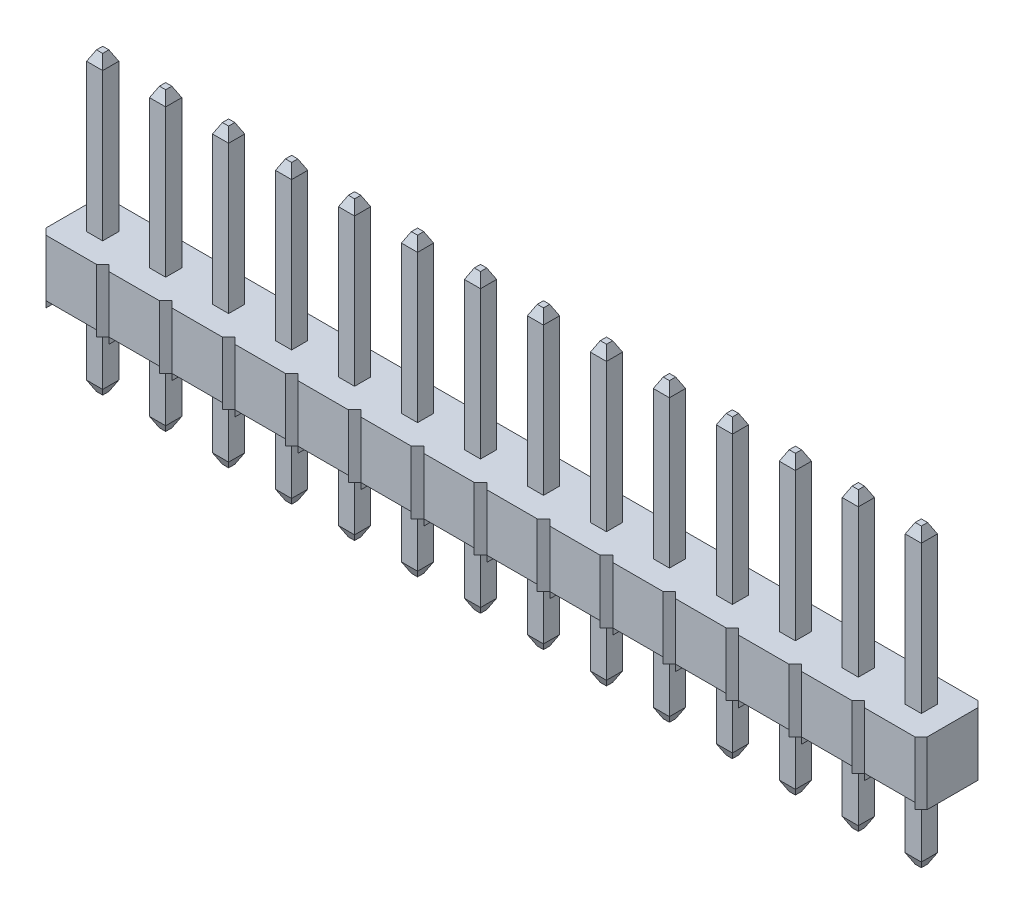
from build123d import *
from OCP.BRepFilletAPI import BRepFilletAPI_MakeChamfer

# Parameters (mm, degrees)
BOSS_EXTRUDE1_START  = -2.286
BOSS_EXTRUDE1_DEPTH  = 2.54
SKETCH2_W            = 2.032
SKETCH2_H            = 2.54
CUT_EXTRUDE1_DEPTH   = 0.254
SKETCH3_W            = 2.032
SKETCH3_H            = 2.54
CUT_EXTRUDE2_DEPTH   = 0.254
SKETCH4_W            = 2.032
SKETCH4_H            = 2.54
CUT_EXTRUDE3_DEPTH   = 0.254
SKETCH5_W            = 2.032
SKETCH5_H            = 2.54
CUT_EXTRUDE4_DEPTH   = 0.254
SKETCH6_W            = 2.032
SKETCH6_H            = 2.54
CUT_EXTRUDE5_DEPTH   = 0.254
SKETCH7_W            = 2.032
SKETCH7_H            = 2.54
CUT_EXTRUDE6_DEPTH   = 0.254
SKETCH8_W            = 2.032
SKETCH8_H            = 2.54
CUT_EXTRUDE7_DEPTH   = 0.254
SKETCH9_W            = 2.032
SKETCH9_H            = 2.54
CUT_EXTRUDE8_DEPTH   = 0.254
SKETCH10_W           = 2.032
SKETCH10_H           = 2.54
CUT_EXTRUDE9_DEPTH   = 0.254
SKETCH11_W           = 2.032
SKETCH11_H           = 2.54
CUT_EXTRUDE10_DEPTH  = 0.254
SKETCH12_W           = 2.032
SKETCH12_H           = 2.54
CUT_EXTRUDE11_DEPTH  = 0.254
SKETCH13_W           = 2.032
SKETCH13_H           = 2.54
CUT_EXTRUDE12_DEPTH  = 0.254
SKETCH14_W           = 2.032
SKETCH14_H           = 2.54
CUT_EXTRUDE13_DEPTH  = 0.254
CUT_EXTRUDE14_DEPTH  = 0.254
CUT_EXTRUDE15_DEPTH  = 0.254
BOSS_EXTRUDE2_DEPTH  = 0.254
BOSS_EXTRUDE3_DEPTH  = 0.254
SKETCH19_W           = 0.65
SKETCH19_H           = 0.65
BOSS_EXTRUDE4_DEPTH  = 3.302
SKETCH20_W           = 0.65
SKETCH20_H           = 0.65
BOSS_EXTRUDE5_DEPTH  = 3.302
SKETCH21_W           = 0.65
SKETCH21_H           = 0.65
BOSS_EXTRUDE6_DEPTH  = 3.302
SKETCH22_W           = 0.65
SKETCH22_H           = 0.65
BOSS_EXTRUDE7_DEPTH  = 3.302
SKETCH23_W           = 0.65
SKETCH23_H           = 0.65
BOSS_EXTRUDE8_DEPTH  = 3.302
SKETCH24_W           = 0.65
SKETCH24_H           = 0.65
BOSS_EXTRUDE9_DEPTH  = 3.302
SKETCH25_W           = 0.65
SKETCH25_H           = 0.65
BOSS_EXTRUDE10_DEPTH = 3.302
SKETCH26_W           = 0.65
SKETCH26_H           = 0.65
BOSS_EXTRUDE11_DEPTH = 3.302
SKETCH27_W           = 0.65
SKETCH27_H           = 0.65
BOSS_EXTRUDE12_DEPTH = 3.302
SKETCH28_W           = 0.65
SKETCH28_H           = 0.65
BOSS_EXTRUDE13_DEPTH = 3.302
SKETCH29_W           = 0.65
SKETCH29_H           = 0.65
BOSS_EXTRUDE14_DEPTH = 3.302
SKETCH30_W           = 0.65
SKETCH30_H           = 0.65
BOSS_EXTRUDE15_DEPTH = 3.302
SKETCH31_W           = 0.65
SKETCH31_H           = 0.65
BOSS_EXTRUDE16_DEPTH = 3.302
SKETCH32_W           = 0.65
SKETCH32_H           = 0.65
BOSS_EXTRUDE17_DEPTH = 3.302
SKETCH33_W           = 0.65
SKETCH33_H           = 0.65
BOSS_EXTRUDE18_DEPTH = 3.302
SKETCH34_W           = 0.65
SKETCH34_H           = 0.65
BOSS_EXTRUDE19_DEPTH = 6.35
SKETCH35_W           = 0.65
SKETCH35_H           = 0.65
BOSS_EXTRUDE20_DEPTH = 6.35
SKETCH36_W           = 0.65
SKETCH36_H           = 0.65
BOSS_EXTRUDE21_DEPTH = 6.35
SKETCH37_W           = 0.65
SKETCH37_H           = 0.65
BOSS_EXTRUDE22_DEPTH = 6.35
SKETCH38_W           = 0.65
SKETCH38_H           = 0.65
BOSS_EXTRUDE23_DEPTH = 6.35
SKETCH39_W           = 0.65
SKETCH39_H           = 0.65
BOSS_EXTRUDE24_DEPTH = 6.35
SKETCH40_W           = 0.65
SKETCH40_H           = 0.65
BOSS_EXTRUDE25_DEPTH = 6.35
SKETCH41_W           = 0.65
SKETCH41_H           = 0.65
BOSS_EXTRUDE26_DEPTH = 6.35
SKETCH42_W           = 0.65
SKETCH42_H           = 0.65
BOSS_EXTRUDE27_DEPTH = 6.35
SKETCH43_W           = 0.65
SKETCH43_H           = 0.65
BOSS_EXTRUDE28_DEPTH = 6.35
SKETCH44_W           = 0.65
SKETCH44_H           = 0.65
BOSS_EXTRUDE29_DEPTH = 6.35
SKETCH45_W           = 0.65
SKETCH45_H           = 0.65
BOSS_EXTRUDE30_DEPTH = 6.35
SKETCH46_W           = 0.65
SKETCH46_H           = 0.65
BOSS_EXTRUDE31_DEPTH = 6.35
SKETCH47_W           = 0.65
SKETCH47_H           = 0.65
BOSS_EXTRUDE32_DEPTH = 6.35
SKETCH48_W           = 0.65
SKETCH48_H           = 0.65
BOSS_EXTRUDE33_DEPTH = 6.35
CHAMFER1_SIZE        = 0.254
CHAMFER2_SIZE        = 0.2
CHAMFER2_SIZE2       = 0.4
SKETCH49_W           = 2.564316688
SKETCH49_H           = 3.089053424
CUT_EXTRUDE16_DEPTH  = 39.737290096


with BuildPart() as part:
    # Boss-Extrude1: read off the stored shape, not the designer's step
    # Boss-Extrude1 outline → Boss-Extrude1 (new body)
    with BuildSketch(Plane.XZ.offset(-0.254).offset(BOSS_EXTRUDE1_START)):
        Polygon((31.496, -1.27), (31.75, -1.016), (32.004, -1.27), (34.036, -1.27), (34.29, -1.016), (34.544, -1.27), (36.576, -1.27), (36.83, -1.016), (36.83, 1.27), (34.544, 1.27), (34.29, 1.016), (34.036, 1.27), (32.004, 1.27), (31.75, 1.016), (31.496, 1.27), (29.464, 1.27), (29.21, 1.016), (28.956, 1.27), (26.924, 1.27), (26.67, 1.016), (26.416, 1.27), (24.384, 1.27), (24.13, 1.016), (23.876, 1.27), (21.844, 1.27), (21.59, 1.016), (21.336, 1.27), (19.304, 1.27), (19.05, 1.016), (18.796, 1.27), (16.764, 1.27), (16.51, 1.016), (16.256, 1.27), (14.224, 1.27), (13.97, 1.016), (13.716, 1.27), (11.684, 1.27), (11.43, 1.016), (11.176, 1.27), (9.144, 1.27), (8.89, 1.016), (8.636, 1.27), (6.604, 1.27), (6.35, 1.016), (6.096, 1.27), (4.064, 1.27), (3.81, 1.016), (3.556, 1.27), (1.524, 1.27), (1.27, 1.016), (1.016, 1.27), (-1.016, 1.27), (-1.27, 1.016), (-1.27, -1.27), (1.016, -1.27), (1.27, -1.016), (1.524, -1.27), (3.556, -1.27), (3.81, -1.016), (4.064, -1.27), (6.096, -1.27), (6.35, -1.016), (6.604, -1.27), (8.636, -1.27), (8.89, -1.016), (9.144, -1.27), (11.176, -1.27), (11.43, -1.016), (11.684, -1.27), (13.716, -1.27), (13.97, -1.016), (14.224, -1.27), (16.256, -1.27), (16.51, -1.016), (16.764, -1.27), (18.796, -1.27), (19.05, -1.016), (19.304, -1.27), (21.336, -1.27), (21.59, -1.016), (21.844, -1.27), (23.876, -1.27), (24.13, -1.016), (24.384, -1.27), (26.416, -1.27), (26.67, -1.016), (26.924, -1.27), (28.956, -1.27), (29.21, -1.016), (29.464, -1.27), align=None)
    extrude(amount=BOSS_EXTRUDE1_DEPTH)

    # Sketch2 → Cut-Extrude1 (cut)
    with BuildSketch(Plane.XZ):
        with Locations((17.78, 0)):
            Rectangle(SKETCH2_W, SKETCH2_H)
    extrude(amount=-CUT_EXTRUDE1_DEPTH, mode=Mode.SUBTRACT)

    # Sketch3 → Cut-Extrude2 (cut)
    with BuildSketch(Plane.XZ):
        with Locations((15.24, 0)):
            Rectangle(SKETCH3_W, SKETCH3_H)
    extrude(amount=-CUT_EXTRUDE2_DEPTH, mode=Mode.SUBTRACT)

    # Sketch4 → Cut-Extrude3 (cut)
    with BuildSketch(Plane.XZ):
        with Locations((20.32, 0)):
            Rectangle(SKETCH4_W, SKETCH4_H)
    extrude(amount=-CUT_EXTRUDE3_DEPTH, mode=Mode.SUBTRACT)

    # Sketch5 → Cut-Extrude4 (cut)
    with BuildSketch(Plane.XZ):
        with Locations((12.7, 0)):
            Rectangle(SKETCH5_W, SKETCH5_H)
    extrude(amount=-CUT_EXTRUDE4_DEPTH, mode=Mode.SUBTRACT)

    # Sketch6 → Cut-Extrude5 (cut)
    with BuildSketch(Plane.XZ):
        with Locations((22.86, 0)):
            Rectangle(SKETCH6_W, SKETCH6_H)
    extrude(amount=-CUT_EXTRUDE5_DEPTH, mode=Mode.SUBTRACT)

    # Sketch7 → Cut-Extrude6 (cut)
    with BuildSketch(Plane.XZ):
        with Locations((10.16, 0)):
            Rectangle(SKETCH7_W, SKETCH7_H)
    extrude(amount=-CUT_EXTRUDE6_DEPTH, mode=Mode.SUBTRACT)

    # Sketch8 → Cut-Extrude7 (cut)
    with BuildSketch(Plane.XZ):
        with Locations((25.4, 0)):
            Rectangle(SKETCH8_W, SKETCH8_H)
    extrude(amount=-CUT_EXTRUDE7_DEPTH, mode=Mode.SUBTRACT)

    # Sketch9 → Cut-Extrude8 (cut)
    with BuildSketch(Plane.XZ):
        with Locations((7.62, 0)):
            Rectangle(SKETCH9_W, SKETCH9_H)
    extrude(amount=-CUT_EXTRUDE8_DEPTH, mode=Mode.SUBTRACT)

    # Sketch10 → Cut-Extrude9 (cut)
    with BuildSketch(Plane.XZ):
        with Locations((27.94, 0)):
            Rectangle(SKETCH10_W, SKETCH10_H)
    extrude(amount=-CUT_EXTRUDE9_DEPTH, mode=Mode.SUBTRACT)

    # Sketch11 → Cut-Extrude10 (cut)
    with BuildSketch(Plane.XZ):
        with Locations((5.08, 0)):
            Rectangle(SKETCH11_W, SKETCH11_H)
    extrude(amount=-CUT_EXTRUDE10_DEPTH, mode=Mode.SUBTRACT)

    # Sketch12 → Cut-Extrude11 (cut)
    with BuildSketch(Plane.XZ):
        with Locations((30.48, 0)):
            Rectangle(SKETCH12_W, SKETCH12_H)
    extrude(amount=-CUT_EXTRUDE11_DEPTH, mode=Mode.SUBTRACT)

    # Sketch13 → Cut-Extrude12 (cut)
    with BuildSketch(Plane.XZ):
        with Locations((2.54, 0)):
            Rectangle(SKETCH13_W, SKETCH13_H)
    extrude(amount=-CUT_EXTRUDE12_DEPTH, mode=Mode.SUBTRACT)

    # Sketch14 → Cut-Extrude13 (cut)
    with BuildSketch(Plane.XZ):
        with Locations((33.02, 0)):
            Rectangle(SKETCH14_W, SKETCH14_H)
    extrude(amount=-CUT_EXTRUDE13_DEPTH, mode=Mode.SUBTRACT)

    # Sketch15 → Cut-Extrude14 (cut)
    with BuildSketch(Plane.XZ):
        Polygon((-1.27, -1.27), (1.016, -1.27), (1.016, 1.27), (-1.016, 1.27), (-1.27, 1.016), align=None)
    extrude(amount=-CUT_EXTRUDE14_DEPTH, mode=Mode.SUBTRACT)

    # Sketch16 → Cut-Extrude15 (cut)
    with BuildSketch(Plane.XZ):
        Polygon((34.544, -1.27), (36.576, -1.27), (36.83, -1.016), (36.83, 1.27), (34.544, 1.27), align=None)
    extrude(amount=-CUT_EXTRUDE15_DEPTH, mode=Mode.SUBTRACT)

    # Sketch17 → Boss-Extrude2 (add)
    with BuildSketch(Plane.XZ.offset(-0.254)):
        Polygon((-1.27, -1.27), (-1.27, 1.016), (-1.016, 1.27), (-1.016, -1.27), align=None)
    extrude(amount=BOSS_EXTRUDE2_DEPTH)

    # Sketch18 → Boss-Extrude3 (add)
    with BuildSketch(Plane.XZ.offset(-0.254)):
        Polygon((36.83, 1.27), (36.83, -1.016), (36.576, -1.27), (36.576, 1.27), align=None)
    extrude(amount=BOSS_EXTRUDE3_DEPTH)

    # Sketch19 → Boss-Extrude4 (add)
    with BuildSketch(Plane.XZ.offset(-0.254)):
        Rectangle(SKETCH19_W, SKETCH19_H)
    extrude(amount=BOSS_EXTRUDE4_DEPTH)

    # Sketch20 → Boss-Extrude5 (add)
    with BuildSketch(Plane.XZ.offset(-0.254)):
        with Locations((2.54, 0)):
            Rectangle(SKETCH20_W, SKETCH20_H)
    extrude(amount=BOSS_EXTRUDE5_DEPTH)

    # Sketch21 → Boss-Extrude6 (add)
    with BuildSketch(Plane.XZ.offset(-0.254)):
        with Locations((5.08, 0)):
            Rectangle(SKETCH21_W, SKETCH21_H)
    extrude(amount=BOSS_EXTRUDE6_DEPTH)

    # Sketch22 → Boss-Extrude7 (add)
    with BuildSketch(Plane.XZ.offset(-0.254)):
        with Locations((7.62, 0)):
            Rectangle(SKETCH22_W, SKETCH22_H)
    extrude(amount=BOSS_EXTRUDE7_DEPTH)

    # Sketch23 → Boss-Extrude8 (add)
    with BuildSketch(Plane.XZ.offset(-0.254)):
        with Locations((10.16, 0)):
            Rectangle(SKETCH23_W, SKETCH23_H)
    extrude(amount=BOSS_EXTRUDE8_DEPTH)

    # Sketch24 → Boss-Extrude9 (add)
    with BuildSketch(Plane.XZ.offset(-0.254)):
        with Locations((12.7, 0)):
            Rectangle(SKETCH24_W, SKETCH24_H)
    extrude(amount=BOSS_EXTRUDE9_DEPTH)

    # Sketch25 → Boss-Extrude10 (add)
    with BuildSketch(Plane.XZ.offset(-0.254)):
        with Locations((15.24, 0)):
            Rectangle(SKETCH25_W, SKETCH25_H)
    extrude(amount=BOSS_EXTRUDE10_DEPTH)

    # Sketch26 → Boss-Extrude11 (add)
    with BuildSketch(Plane.XZ.offset(-0.254)):
        with Locations((17.78, 0)):
            Rectangle(SKETCH26_W, SKETCH26_H)
    extrude(amount=BOSS_EXTRUDE11_DEPTH)

    # Sketch27 → Boss-Extrude12 (add)
    with BuildSketch(Plane.XZ.offset(-0.254)):
        with Locations((20.32, 0)):
            Rectangle(SKETCH27_W, SKETCH27_H)
    extrude(amount=BOSS_EXTRUDE12_DEPTH)

    # Sketch28 → Boss-Extrude13 (add)
    with BuildSketch(Plane.XZ.offset(-0.254)):
        with Locations((22.86, 0)):
            Rectangle(SKETCH28_W, SKETCH28_H)
    extrude(amount=BOSS_EXTRUDE13_DEPTH)

    # Sketch29 → Boss-Extrude14 (add)
    with BuildSketch(Plane.XZ.offset(-0.254)):
        with Locations((25.4, 0)):
            Rectangle(SKETCH29_W, SKETCH29_H)
    extrude(amount=BOSS_EXTRUDE14_DEPTH)

    # Sketch30 → Boss-Extrude15 (add)
    with BuildSketch(Plane.XZ.offset(-0.254)):
        with Locations((27.94, 0)):
            Rectangle(SKETCH30_W, SKETCH30_H)
    extrude(amount=BOSS_EXTRUDE15_DEPTH)

    # Sketch31 → Boss-Extrude16 (add)
    with BuildSketch(Plane.XZ.offset(-0.254)):
        with Locations((30.48, 0)):
            Rectangle(SKETCH31_W, SKETCH31_H)
    extrude(amount=BOSS_EXTRUDE16_DEPTH)

    # Sketch32 → Boss-Extrude17 (add)
    with BuildSketch(Plane.XZ.offset(-0.254)):
        with Locations((33.02, 0)):
            Rectangle(SKETCH32_W, SKETCH32_H)
    extrude(amount=BOSS_EXTRUDE17_DEPTH)

    # Sketch33 → Boss-Extrude18 (add)
    with BuildSketch(Plane.XZ.offset(-0.254)):
        with Locations((35.56, 0)):
            Rectangle(SKETCH33_W, SKETCH33_H)
    extrude(amount=BOSS_EXTRUDE18_DEPTH)

    # Sketch34 → Boss-Extrude19 (add)
    with BuildSketch(Plane(origin=(0, 2.54, 0), x_dir=(-1, 0, 0), z_dir=(0, 1, 0))):
        Rectangle(SKETCH34_W, SKETCH34_H)
    extrude(amount=BOSS_EXTRUDE19_DEPTH)

    # Sketch35 → Boss-Extrude20 (add)
    with BuildSketch(Plane(origin=(0, 2.54, 0), x_dir=(-1, 0, 0), z_dir=(0, 1, 0))):
        with Locations((-2.54, 0)):
            Rectangle(SKETCH35_W, SKETCH35_H)
    extrude(amount=BOSS_EXTRUDE20_DEPTH)

    # Sketch36 → Boss-Extrude21 (add)
    with BuildSketch(Plane(origin=(0, 2.54, 0), x_dir=(-1, 0, 0), z_dir=(0, 1, 0))):
        with Locations((-5.08, 0)):
            Rectangle(SKETCH36_W, SKETCH36_H)
    extrude(amount=BOSS_EXTRUDE21_DEPTH)

    # Sketch37 → Boss-Extrude22 (add)
    with BuildSketch(Plane(origin=(0, 2.54, 0), x_dir=(-1, 0, 0), z_dir=(0, 1, 0))):
        with Locations((-7.62, 0)):
            Rectangle(SKETCH37_W, SKETCH37_H)
    extrude(amount=BOSS_EXTRUDE22_DEPTH)

    # Sketch38 → Boss-Extrude23 (add)
    with BuildSketch(Plane(origin=(0, 2.54, 0), x_dir=(-1, 0, 0), z_dir=(0, 1, 0))):
        with Locations((-10.16, 0)):
            Rectangle(SKETCH38_W, SKETCH38_H)
    extrude(amount=BOSS_EXTRUDE23_DEPTH)

    # Sketch39 → Boss-Extrude24 (add)
    with BuildSketch(Plane(origin=(0, 2.54, 0), x_dir=(-1, 0, 0), z_dir=(0, 1, 0))):
        with Locations((-12.7, 0)):
            Rectangle(SKETCH39_W, SKETCH39_H)
    extrude(amount=BOSS_EXTRUDE24_DEPTH)

    # Sketch40 → Boss-Extrude25 (add)
    with BuildSketch(Plane(origin=(0, 2.54, 0), x_dir=(-1, 0, 0), z_dir=(0, 1, 0))):
        with Locations((-15.24, 0)):
            Rectangle(SKETCH40_W, SKETCH40_H)
    extrude(amount=BOSS_EXTRUDE25_DEPTH)

    # Sketch41 → Boss-Extrude26 (add)
    with BuildSketch(Plane(origin=(0, 2.54, 0), x_dir=(-1, 0, 0), z_dir=(0, 1, 0))):
        with Locations((-17.78, 0)):
            Rectangle(SKETCH41_W, SKETCH41_H)
    extrude(amount=BOSS_EXTRUDE26_DEPTH)

    # Sketch42 → Boss-Extrude27 (add)
    with BuildSketch(Plane(origin=(0, 2.54, 0), x_dir=(-1, 0, 0), z_dir=(0, 1, 0))):
        with Locations((-20.32, 0)):
            Rectangle(SKETCH42_W, SKETCH42_H)
    extrude(amount=BOSS_EXTRUDE27_DEPTH)

    # Sketch43 → Boss-Extrude28 (add)
    with BuildSketch(Plane(origin=(0, 2.54, 0), x_dir=(-1, 0, 0), z_dir=(0, 1, 0))):
        with Locations((-22.86, 0)):
            Rectangle(SKETCH43_W, SKETCH43_H)
    extrude(amount=BOSS_EXTRUDE28_DEPTH)

    # Sketch44 → Boss-Extrude29 (add)
    with BuildSketch(Plane(origin=(0, 2.54, 0), x_dir=(-1, 0, 0), z_dir=(0, 1, 0))):
        with Locations((-25.4, 0)):
            Rectangle(SKETCH44_W, SKETCH44_H)
    extrude(amount=BOSS_EXTRUDE29_DEPTH)

    # Sketch45 → Boss-Extrude30 (add)
    with BuildSketch(Plane(origin=(0, 2.54, 0), x_dir=(-1, 0, 0), z_dir=(0, 1, 0))):
        with Locations((-27.94, 0)):
            Rectangle(SKETCH45_W, SKETCH45_H)
    extrude(amount=BOSS_EXTRUDE30_DEPTH)

    # Sketch46 → Boss-Extrude31 (add)
    with BuildSketch(Plane(origin=(0, 2.54, 0), x_dir=(-1, 0, 0), z_dir=(0, 1, 0))):
        with Locations((-30.48, 0)):
            Rectangle(SKETCH46_W, SKETCH46_H)
    extrude(amount=BOSS_EXTRUDE31_DEPTH)

    # Sketch47 → Boss-Extrude32 (add)
    with BuildSketch(Plane(origin=(0, 2.54, 0), x_dir=(-1, 0, 0), z_dir=(0, 1, 0))):
        with Locations((-33.02, 0)):
            Rectangle(SKETCH47_W, SKETCH47_H)
    extrude(amount=BOSS_EXTRUDE32_DEPTH)

    # Sketch48 → Boss-Extrude33 (add)
    with BuildSketch(Plane(origin=(0, 2.54, 0), x_dir=(-1, 0, 0), z_dir=(0, 1, 0))):
        with Locations((-35.56, 0)):
            Rectangle(SKETCH48_W, SKETCH48_H)
    extrude(amount=BOSS_EXTRUDE33_DEPTH)

    # Chamfer1
    chamfer1_edges = [part.edges().sort_by_distance(p)[0] for p in [
        (36.83, 1.27, 1.27),
        (-1.27, 1.27, -1.27),
    ]]
    chamfer(chamfer1_edges, length=CHAMFER1_SIZE)

    # Chamfer2: one chamfer whose edges measure the first distance from different faces: ONE call of the kernel's chamfer builder (chamfer() names one face for all edges)
    chamfer2_edges_1 = [part.edges().sort_by_distance(p)[0] for p in [
        (-0.325, -3.048, 0),
        (0, -3.048, -0.325),
        (0.325, -3.048, 0),
        (0, -3.048, 0.325),
    ]]
    chamfer2_side_1 = [part.faces().sort_by_distance(p)[0] for p in [
        (0, -3.048, 0),
    ]]
    chamfer2_edges_2 = [part.edges().sort_by_distance(p)[0] for p in [
        (2.54, -3.048, -0.325),
        (2.865, -3.048, 0),
        (2.54, -3.048, 0.325),
        (2.215, -3.048, 0),
    ]]
    chamfer2_side_2 = [part.faces().sort_by_distance(p)[0] for p in [
        (2.54, -3.048, 0),
    ]]
    chamfer2_edges_3 = [part.edges().sort_by_distance(p)[0] for p in [
        (5.08, -3.048, -0.325),
        (5.405, -3.048, 0),
        (5.08, -3.048, 0.325),
        (4.755, -3.048, 0),
    ]]
    chamfer2_side_3 = [part.faces().sort_by_distance(p)[0] for p in [
        (5.08, -3.048, 0),
    ]]
    chamfer2_edges_4 = [part.edges().sort_by_distance(p)[0] for p in [
        (7.62, -3.048, -0.325),
        (7.945, -3.048, 0),
        (7.62, -3.048, 0.325),
        (7.295, -3.048, 0),
    ]]
    chamfer2_side_4 = [part.faces().sort_by_distance(p)[0] for p in [
        (7.62, -3.048, 0),
    ]]
    chamfer2_edges_5 = [part.edges().sort_by_distance(p)[0] for p in [
        (10.16, -3.048, -0.325),
        (10.485, -3.048, 0),
        (10.16, -3.048, 0.325),
        (9.835, -3.048, 0),
    ]]
    chamfer2_side_5 = [part.faces().sort_by_distance(p)[0] for p in [
        (10.16, -3.048, 0),
    ]]
    chamfer2_edges_6 = [part.edges().sort_by_distance(p)[0] for p in [
        (12.7, -3.048, -0.325),
        (13.025, -3.048, 0),
        (12.7, -3.048, 0.325),
        (12.375, -3.048, 0),
    ]]
    chamfer2_side_6 = [part.faces().sort_by_distance(p)[0] for p in [
        (12.7, -3.048, 0),
    ]]
    chamfer2_edges_7 = [part.edges().sort_by_distance(p)[0] for p in [
        (15.24, -3.048, -0.325),
        (15.565, -3.048, 0),
        (15.24, -3.048, 0.325),
        (14.915, -3.048, 0),
    ]]
    chamfer2_side_7 = [part.faces().sort_by_distance(p)[0] for p in [
        (15.24, -3.048, 0),
    ]]
    chamfer2_edges_8 = [part.edges().sort_by_distance(p)[0] for p in [
        (17.78, -3.048, -0.325),
        (18.105, -3.048, 0),
        (17.78, -3.048, 0.325),
        (17.455, -3.048, 0),
    ]]
    chamfer2_side_8 = [part.faces().sort_by_distance(p)[0] for p in [
        (17.78, -3.048, 0),
    ]]
    chamfer2_edges_9 = [part.edges().sort_by_distance(p)[0] for p in [
        (20.32, -3.048, -0.325),
        (20.645, -3.048, 0),
        (20.32, -3.048, 0.325),
        (19.995, -3.048, 0),
    ]]
    chamfer2_side_9 = [part.faces().sort_by_distance(p)[0] for p in [
        (20.32, -3.048, 0),
    ]]
    chamfer2_edges_10 = [part.edges().sort_by_distance(p)[0] for p in [
        (22.86, -3.048, -0.325),
        (23.185, -3.048, 0),
        (22.86, -3.048, 0.325),
        (22.535, -3.048, 0),
    ]]
    chamfer2_side_10 = [part.faces().sort_by_distance(p)[0] for p in [
        (22.86, -3.048, 0),
    ]]
    chamfer2_edges_11 = [part.edges().sort_by_distance(p)[0] for p in [
        (25.4, -3.048, -0.325),
        (25.725, -3.048, 0),
        (25.4, -3.048, 0.325),
        (25.075, -3.048, 0),
    ]]
    chamfer2_side_11 = [part.faces().sort_by_distance(p)[0] for p in [
        (25.4, -3.048, 0),
    ]]
    chamfer2_edges_12 = [part.edges().sort_by_distance(p)[0] for p in [
        (27.94, -3.048, -0.325),
        (28.265, -3.048, 0),
        (27.94, -3.048, 0.325),
        (27.615, -3.048, 0),
    ]]
    chamfer2_side_12 = [part.faces().sort_by_distance(p)[0] for p in [
        (27.94, -3.048, 0),
    ]]
    chamfer2_edges_13 = [part.edges().sort_by_distance(p)[0] for p in [
        (30.48, -3.048, -0.325),
        (30.805, -3.048, 0),
        (30.48, -3.048, 0.325),
        (30.155, -3.048, 0),
    ]]
    chamfer2_side_13 = [part.faces().sort_by_distance(p)[0] for p in [
        (30.48, -3.048, 0),
    ]]
    chamfer2_edges_14 = [part.edges().sort_by_distance(p)[0] for p in [
        (33.02, -3.048, -0.325),
        (33.345, -3.048, 0),
        (33.02, -3.048, 0.325),
        (32.695, -3.048, 0),
    ]]
    chamfer2_side_14 = [part.faces().sort_by_distance(p)[0] for p in [
        (33.02, -3.048, 0),
    ]]
    chamfer2_edges_15 = [part.edges().sort_by_distance(p)[0] for p in [
        (35.56, -3.048, -0.325),
        (35.885, -3.048, 0),
        (35.56, -3.048, 0.325),
        (35.235, -3.048, 0),
    ]]
    chamfer2_side_15 = [part.faces().sort_by_distance(p)[0] for p in [
        (35.56, -3.048, 0),
    ]]
    chamfer2_edges_16 = [part.edges().sort_by_distance(p)[0] for p in [
        (0, 8.89, 0.325),
        (0.325, 8.89, 0),
        (0, 8.89, -0.325),
        (-0.325, 8.89, 0),
    ]]
    chamfer2_side_16 = [part.faces().sort_by_distance(p)[0] for p in [
        (0, 8.89, 0),
    ]]
    chamfer2_edges_17 = [part.edges().sort_by_distance(p)[0] for p in [
        (2.54, 8.89, 0.325),
        (2.865, 8.89, 0),
        (2.54, 8.89, -0.325),
        (2.215, 8.89, 0),
    ]]
    chamfer2_side_17 = [part.faces().sort_by_distance(p)[0] for p in [
        (2.54, 8.89, 0),
    ]]
    chamfer2_edges_18 = [part.edges().sort_by_distance(p)[0] for p in [
        (5.08, 8.89, 0.325),
        (5.405, 8.89, 0),
        (5.08, 8.89, -0.325),
        (4.755, 8.89, 0),
    ]]
    chamfer2_side_18 = [part.faces().sort_by_distance(p)[0] for p in [
        (5.08, 8.89, 0),
    ]]
    chamfer2_edges_19 = [part.edges().sort_by_distance(p)[0] for p in [
        (7.945, 8.89, 0),
        (7.62, 8.89, -0.325),
        (7.295, 8.89, 0),
        (7.62, 8.89, 0.325),
    ]]
    chamfer2_side_19 = [part.faces().sort_by_distance(p)[0] for p in [
        (7.62, 8.89, 0),
    ]]
    chamfer2_edges_20 = [part.edges().sort_by_distance(p)[0] for p in [
        (10.16, 8.89, 0.325),
        (10.485, 8.89, 0),
        (10.16, 8.89, -0.325),
        (9.835, 8.89, 0),
    ]]
    chamfer2_side_20 = [part.faces().sort_by_distance(p)[0] for p in [
        (10.16, 8.89, 0),
    ]]
    chamfer2_edges_21 = [part.edges().sort_by_distance(p)[0] for p in [
        (13.025, 8.89, 0),
        (12.7, 8.89, -0.325),
        (12.375, 8.89, 0),
        (12.7, 8.89, 0.325),
    ]]
    chamfer2_side_21 = [part.faces().sort_by_distance(p)[0] for p in [
        (12.7, 8.89, 0),
    ]]
    chamfer2_edges_22 = [part.edges().sort_by_distance(p)[0] for p in [
        (15.24, 8.89, 0.325),
        (15.565, 8.89, 0),
        (15.24, 8.89, -0.325),
        (14.915, 8.89, 0),
    ]]
    chamfer2_side_22 = [part.faces().sort_by_distance(p)[0] for p in [
        (15.24, 8.89, 0),
    ]]
    chamfer2_edges_23 = [part.edges().sort_by_distance(p)[0] for p in [
        (18.105, 8.89, 0),
        (17.78, 8.89, -0.325),
        (17.455, 8.89, 0),
        (17.78, 8.89, 0.325),
    ]]
    chamfer2_side_23 = [part.faces().sort_by_distance(p)[0] for p in [
        (17.78, 8.89, 0),
    ]]
    chamfer2_edges_24 = [part.edges().sort_by_distance(p)[0] for p in [
        (20.32, 8.89, 0.325),
        (20.645, 8.89, 0),
        (20.32, 8.89, -0.325),
        (19.995, 8.89, 0),
    ]]
    chamfer2_side_24 = [part.faces().sort_by_distance(p)[0] for p in [
        (20.32, 8.89, 0),
    ]]
    chamfer2_edges_25 = [part.edges().sort_by_distance(p)[0] for p in [
        (23.185, 8.89, 0),
        (22.86, 8.89, -0.325),
        (22.535, 8.89, 0),
        (22.86, 8.89, 0.325),
    ]]
    chamfer2_side_25 = [part.faces().sort_by_distance(p)[0] for p in [
        (22.86, 8.89, 0),
    ]]
    chamfer2_edges_26 = [part.edges().sort_by_distance(p)[0] for p in [
        (25.4, 8.89, 0.325),
        (25.725, 8.89, 0),
        (25.4, 8.89, -0.325),
        (25.075, 8.89, 0),
    ]]
    chamfer2_side_26 = [part.faces().sort_by_distance(p)[0] for p in [
        (25.4, 8.89, 0),
    ]]
    chamfer2_edges_27 = [part.edges().sort_by_distance(p)[0] for p in [
        (28.265, 8.89, 0),
        (27.94, 8.89, -0.325),
        (27.615, 8.89, 0),
        (27.94, 8.89, 0.325),
    ]]
    chamfer2_side_27 = [part.faces().sort_by_distance(p)[0] for p in [
        (27.94, 8.89, 0),
    ]]
    chamfer2_edges_28 = [part.edges().sort_by_distance(p)[0] for p in [
        (30.48, 8.89, 0.325),
        (30.805, 8.89, 0),
        (30.48, 8.89, -0.325),
        (30.155, 8.89, 0),
    ]]
    chamfer2_side_28 = [part.faces().sort_by_distance(p)[0] for p in [
        (30.48, 8.89, 0),
    ]]
    chamfer2_edges_29 = [part.edges().sort_by_distance(p)[0] for p in [
        (33.345, 8.89, 0),
        (33.02, 8.89, -0.325),
        (32.695, 8.89, 0),
        (33.02, 8.89, 0.325),
    ]]
    chamfer2_side_29 = [part.faces().sort_by_distance(p)[0] for p in [
        (33.02, 8.89, 0),
    ]]
    chamfer2_edges_30 = [part.edges().sort_by_distance(p)[0] for p in [
        (35.56, 8.89, 0.325),
        (35.885, 8.89, 0),
        (35.56, 8.89, -0.325),
        (35.235, 8.89, 0),
    ]]
    chamfer2_side_30 = [part.faces().sort_by_distance(p)[0] for p in [
        (35.56, 8.89, 0),
    ]]
    chamfer2 = BRepFilletAPI_MakeChamfer(part.part.solid().wrapped)
    for e in chamfer2_edges_1:
        chamfer2.Add(CHAMFER2_SIZE, CHAMFER2_SIZE2, e.wrapped, chamfer2_side_1[0].wrapped)  # the first distance lies on this face
    for e in chamfer2_edges_2:
        chamfer2.Add(CHAMFER2_SIZE, CHAMFER2_SIZE2, e.wrapped, chamfer2_side_2[0].wrapped)  # the first distance lies on this face
    for e in chamfer2_edges_3:
        chamfer2.Add(CHAMFER2_SIZE, CHAMFER2_SIZE2, e.wrapped, chamfer2_side_3[0].wrapped)  # the first distance lies on this face
    for e in chamfer2_edges_4:
        chamfer2.Add(CHAMFER2_SIZE, CHAMFER2_SIZE2, e.wrapped, chamfer2_side_4[0].wrapped)  # the first distance lies on this face
    for e in chamfer2_edges_5:
        chamfer2.Add(CHAMFER2_SIZE, CHAMFER2_SIZE2, e.wrapped, chamfer2_side_5[0].wrapped)  # the first distance lies on this face
    for e in chamfer2_edges_6:
        chamfer2.Add(CHAMFER2_SIZE, CHAMFER2_SIZE2, e.wrapped, chamfer2_side_6[0].wrapped)  # the first distance lies on this face
    for e in chamfer2_edges_7:
        chamfer2.Add(CHAMFER2_SIZE, CHAMFER2_SIZE2, e.wrapped, chamfer2_side_7[0].wrapped)  # the first distance lies on this face
    for e in chamfer2_edges_8:
        chamfer2.Add(CHAMFER2_SIZE, CHAMFER2_SIZE2, e.wrapped, chamfer2_side_8[0].wrapped)  # the first distance lies on this face
    for e in chamfer2_edges_9:
        chamfer2.Add(CHAMFER2_SIZE, CHAMFER2_SIZE2, e.wrapped, chamfer2_side_9[0].wrapped)  # the first distance lies on this face
    for e in chamfer2_edges_10:
        chamfer2.Add(CHAMFER2_SIZE, CHAMFER2_SIZE2, e.wrapped, chamfer2_side_10[0].wrapped)  # the first distance lies on this face
    for e in chamfer2_edges_11:
        chamfer2.Add(CHAMFER2_SIZE, CHAMFER2_SIZE2, e.wrapped, chamfer2_side_11[0].wrapped)  # the first distance lies on this face
    for e in chamfer2_edges_12:
        chamfer2.Add(CHAMFER2_SIZE, CHAMFER2_SIZE2, e.wrapped, chamfer2_side_12[0].wrapped)  # the first distance lies on this face
    for e in chamfer2_edges_13:
        chamfer2.Add(CHAMFER2_SIZE, CHAMFER2_SIZE2, e.wrapped, chamfer2_side_13[0].wrapped)  # the first distance lies on this face
    for e in chamfer2_edges_14:
        chamfer2.Add(CHAMFER2_SIZE, CHAMFER2_SIZE2, e.wrapped, chamfer2_side_14[0].wrapped)  # the first distance lies on this face
    for e in chamfer2_edges_15:
        chamfer2.Add(CHAMFER2_SIZE, CHAMFER2_SIZE2, e.wrapped, chamfer2_side_15[0].wrapped)  # the first distance lies on this face
    for e in chamfer2_edges_16:
        chamfer2.Add(CHAMFER2_SIZE, CHAMFER2_SIZE2, e.wrapped, chamfer2_side_16[0].wrapped)  # the first distance lies on this face
    for e in chamfer2_edges_17:
        chamfer2.Add(CHAMFER2_SIZE, CHAMFER2_SIZE2, e.wrapped, chamfer2_side_17[0].wrapped)  # the first distance lies on this face
    for e in chamfer2_edges_18:
        chamfer2.Add(CHAMFER2_SIZE, CHAMFER2_SIZE2, e.wrapped, chamfer2_side_18[0].wrapped)  # the first distance lies on this face
    for e in chamfer2_edges_19:
        chamfer2.Add(CHAMFER2_SIZE, CHAMFER2_SIZE2, e.wrapped, chamfer2_side_19[0].wrapped)  # the first distance lies on this face
    for e in chamfer2_edges_20:
        chamfer2.Add(CHAMFER2_SIZE, CHAMFER2_SIZE2, e.wrapped, chamfer2_side_20[0].wrapped)  # the first distance lies on this face
    for e in chamfer2_edges_21:
        chamfer2.Add(CHAMFER2_SIZE, CHAMFER2_SIZE2, e.wrapped, chamfer2_side_21[0].wrapped)  # the first distance lies on this face
    for e in chamfer2_edges_22:
        chamfer2.Add(CHAMFER2_SIZE, CHAMFER2_SIZE2, e.wrapped, chamfer2_side_22[0].wrapped)  # the first distance lies on this face
    for e in chamfer2_edges_23:
        chamfer2.Add(CHAMFER2_SIZE, CHAMFER2_SIZE2, e.wrapped, chamfer2_side_23[0].wrapped)  # the first distance lies on this face
    for e in chamfer2_edges_24:
        chamfer2.Add(CHAMFER2_SIZE, CHAMFER2_SIZE2, e.wrapped, chamfer2_side_24[0].wrapped)  # the first distance lies on this face
    for e in chamfer2_edges_25:
        chamfer2.Add(CHAMFER2_SIZE, CHAMFER2_SIZE2, e.wrapped, chamfer2_side_25[0].wrapped)  # the first distance lies on this face
    for e in chamfer2_edges_26:
        chamfer2.Add(CHAMFER2_SIZE, CHAMFER2_SIZE2, e.wrapped, chamfer2_side_26[0].wrapped)  # the first distance lies on this face
    for e in chamfer2_edges_27:
        chamfer2.Add(CHAMFER2_SIZE, CHAMFER2_SIZE2, e.wrapped, chamfer2_side_27[0].wrapped)  # the first distance lies on this face
    for e in chamfer2_edges_28:
        chamfer2.Add(CHAMFER2_SIZE, CHAMFER2_SIZE2, e.wrapped, chamfer2_side_28[0].wrapped)  # the first distance lies on this face
    for e in chamfer2_edges_29:
        chamfer2.Add(CHAMFER2_SIZE, CHAMFER2_SIZE2, e.wrapped, chamfer2_side_29[0].wrapped)  # the first distance lies on this face
    for e in chamfer2_edges_30:
        chamfer2.Add(CHAMFER2_SIZE, CHAMFER2_SIZE2, e.wrapped, chamfer2_side_30[0].wrapped)  # the first distance lies on this face
    add(Compound.cast(chamfer2.Shape()), mode=Mode.REPLACE)

    # Sketch49 → Cut-Extrude16 (cut, through all)
    with BuildSketch(Plane(origin=(0, 8.89, 0), x_dir=(1, 0, 0), z_dir=(0, 1, 0))):
        with Locations((35.561794436, 0)):
            Rectangle(SKETCH49_W, SKETCH49_H)
    extrude(amount=-CUT_EXTRUDE16_DEPTH, mode=Mode.SUBTRACT)


solid = part.part
